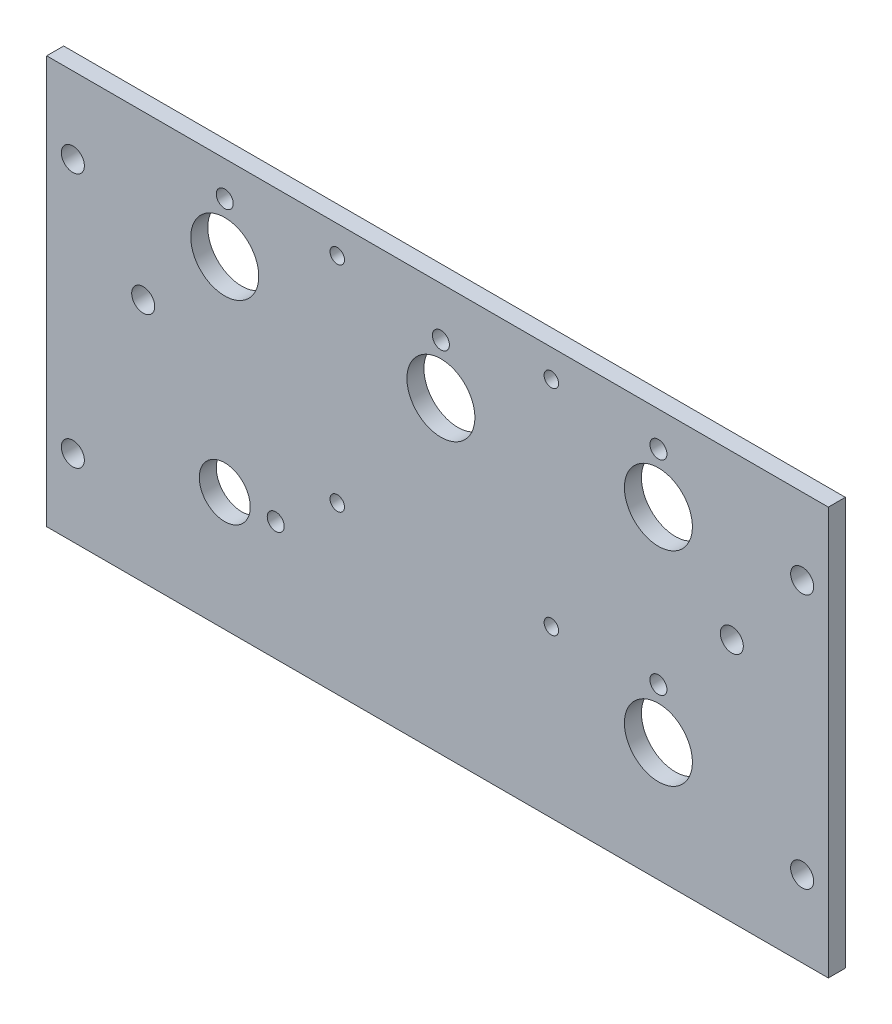
from build123d import *

# Parameters (mm, degrees)
SKETCH1_W                                         = 146.05
SKETCH1_H                                         = 76.2
BOSS_EXTRUDE1_DEPTH                               = 3.175
F_6_CLEARANCE_HOLE1_D                             = 4.3053
F_3_8_0_375_DIAMETER_HOLE1_D                      = 9.525
F_1_2_0_5_DIAMETER_HOLE1_D                        = 12.7
F_1_8_0_125_DIAMETER_HOLE1_D                      = 3.175
CSK_FOR_2_FLAT_HEAD_MACHINE_SCREW_100_D           = 2.7051
CSK_FOR_2_FLAT_HEAD_MACHINE_SCREW_100_CSINK_D     = 4.3688
CSK_FOR_2_FLAT_HEAD_MACHINE_SCREW_100_CSINK_ANGLE = 100


with BuildPart() as part:
    # Sketch1 → Boss-Extrude1 (new body)
    with BuildSketch(Plane.XY):
        with Locations((-73.025, 38.1)):
            Rectangle(SKETCH1_W, SKETCH1_H)
    extrude(amount=-BOSS_EXTRUDE1_DEPTH)

    # #6 Clearance Hole1 (through all)
    with Locations(Plane(origin=(0, 0, -3.175), x_dir=(-1, 0, 0), z_dir=(0, 0, -1))):
        with Locations((4.8895, 61.9125), (4.8895, 14.2875), (141.1605, 14.2875), (141.1605, 61.9125), (128.016, 45.72), (18.034, 45.72)):
            Hole(F_6_CLEARANCE_HOLE1_D / 2)

    # 3/8 (0.375) Diameter Hole1 (through all)
    with Locations(Plane(origin=(0, 0, -3.175), x_dir=(-1, 0, 0), z_dir=(0, 0, -1))):
        with Locations((112.776, 22.225)):
            Hole(F_3_8_0_375_DIAMETER_HOLE1_D / 2)

    # 1/2 (0.5) Diameter Hole1 (through all)
    with Locations(Plane(origin=(0, 0, -3.175), x_dir=(-1, 0, 0), z_dir=(0, 0, -1))):
        with Locations((31.75, 60.325), (72.39, 57.658), (112.776, 60.325), (31.75, 22.225)):
            Hole(F_1_2_0_5_DIAMETER_HOLE1_D / 2)

    # 1/8 (0.125) Diameter Hole1 (through all)
    with Locations(Plane(origin=(0, 0, -3.175), x_dir=(-1, 0, 0), z_dir=(0, 0, -1))):
        with Locations((31.75, 69.699492067), (112.776, 69.699492067), (103.251, 22.225), (72.39, 67.032492067), (31.75, 31.599492067)):
            Hole(F_1_8_0_125_DIAMETER_HOLE1_D / 2)

    # CSK for #2 Flat Head Machine Screw (100)1 (through all)
    with Locations(Plane(origin=(0, 0, -3.175), x_dir=(-1, 0, 0), z_dir=(0, 0, -1))):
        with Locations((51.753006, 70.995097), (91.753006, 70.995097), (91.753006, 30.995097), (51.753006, 30.995097)):
            CounterSinkHole(CSK_FOR_2_FLAT_HEAD_MACHINE_SCREW_100_D / 2, CSK_FOR_2_FLAT_HEAD_MACHINE_SCREW_100_CSINK_D / 2, counter_sink_angle=CSK_FOR_2_FLAT_HEAD_MACHINE_SCREW_100_CSINK_ANGLE)


solid = part.part
